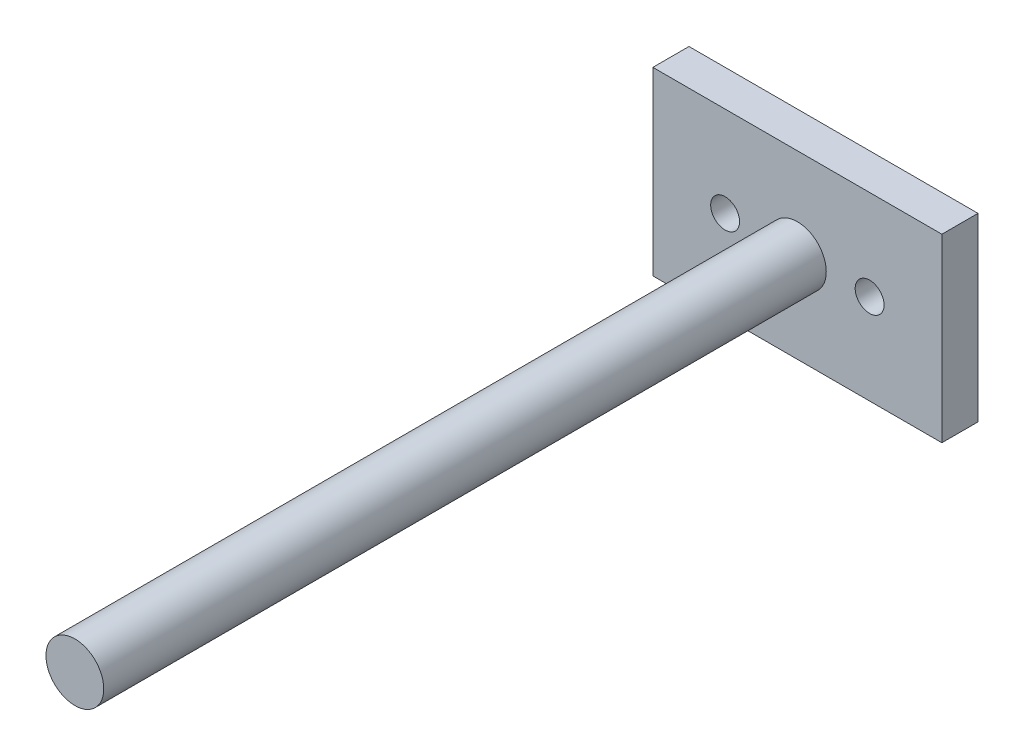
from build123d import *

# Parameters (mm, degrees)
ESBO_O1_R                = 4
RESSALTO_EXTRUS_O1_DEPTH = 100
ESBO_O1_3_W              = 40
ESBO_O1_3_H              = 25
ESBO_O1_3_R              = 2
RESSALTO_EXTRUS_O2_DEPTH = 5


with BuildPart() as part:
    # Esboço1 → Ressalto-extrusão1 (new body)
    with BuildSketch(Plane.XY):
        Circle(ESBO_O1_R)
    extrude(amount=RESSALTO_EXTRUS_O1_DEPTH)


with BuildPart() as body_2:
    # Esboço1<3> → Ressalto-extrusão2 (new body)
    with BuildSketch(Plane.XY):
        Rectangle(ESBO_O1_3_W, ESBO_O1_3_H)
        with Locations((-10, 0)):
            Circle(ESBO_O1_3_R, mode=Mode.SUBTRACT)
        with Locations((10, 0)):
            Circle(ESBO_O1_3_R, mode=Mode.SUBTRACT)
    extrude(amount=-RESSALTO_EXTRUS_O2_DEPTH)


solid = Compound([part.part, body_2.part])
